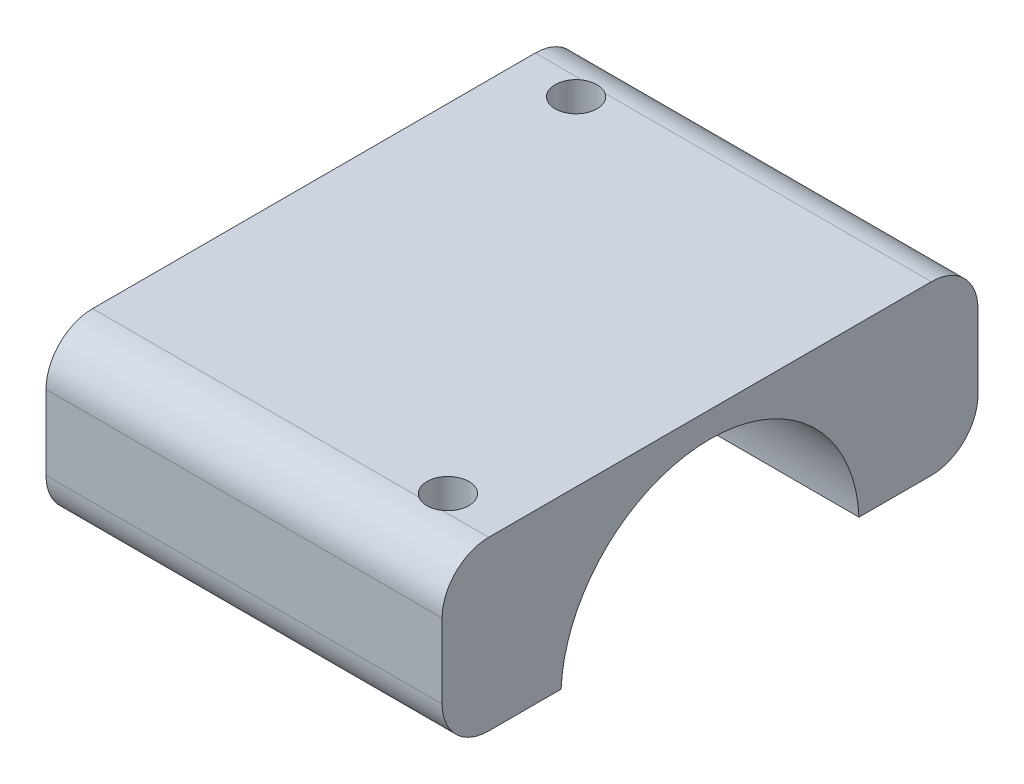
from build123d import *

# Parameters (mm, degrees)
BOSS_EXTRUDE1_DEPTH     = 17
CUT_EXTRUDE1_DEPTH      = 33.295046075
CUT_EXTRUDE1_DEPTH_BACK = 33.295046075
SKETCH2_R               = 12.8
SKETCH3_R               = 1.8
CUT_EXTRUDE2_DEPTH      = 14.999


with BuildPart() as part:
    # Sketch1 → Boss-Extrude1 (new, symmetric)
    with BuildSketch(Plane(origin=(0, 0, 0), x_dir=(0, 0, -1), z_dir=(1, 0, 0))):
        with BuildLine():
            Line((-19, 0.6), (19, 0.6))
            ThreePointArc((19, 0.6), (21.828427125, 1.771572875), (23, 4.6))
            Line((23, 4.6), (23, 10.999))
            ThreePointArc((23, 10.999), (21.828427125, 13.827427125), (19, 14.999))
            Line((19, 14.999), (-19, 14.999))
            ThreePointArc((-19, 14.999), (-21.828427125, 13.827427125), (-23, 10.999))
            Line((-23, 10.999), (-23, 4.6))
            ThreePointArc((-23, 4.6), (-21.828427125, 1.771572875), (-19, 0.6))
        make_face()
    extrude(amount=BOSS_EXTRUDE1_DEPTH, both=True)

    # Sketch2 → Cut-Extrude1 (cut, two sides: drawn at the far end of the back side and taken through both)
    with BuildSketch(Plane(origin=(0, 0, 0), x_dir=(0, 0, -1), z_dir=(1, 0, 0)).offset(-CUT_EXTRUDE1_DEPTH_BACK)):
        Circle(SKETCH2_R)
    extrude(amount=CUT_EXTRUDE1_DEPTH + CUT_EXTRUDE1_DEPTH_BACK, mode=Mode.SUBTRACT)

    # Sketch3 → Cut-Extrude2 (cut)
    with BuildSketch(Plane(origin=(0, 0.6, 0), x_dir=(1, 0, 0), z_dir=(0, 1, 0))):
        with Locations((12, -17.5)):
            Circle(SKETCH3_R)
        with Locations((-12, 17.5)):
            Circle(SKETCH3_R)
    extrude(amount=CUT_EXTRUDE2_DEPTH, mode=Mode.SUBTRACT)


solid = part.part
